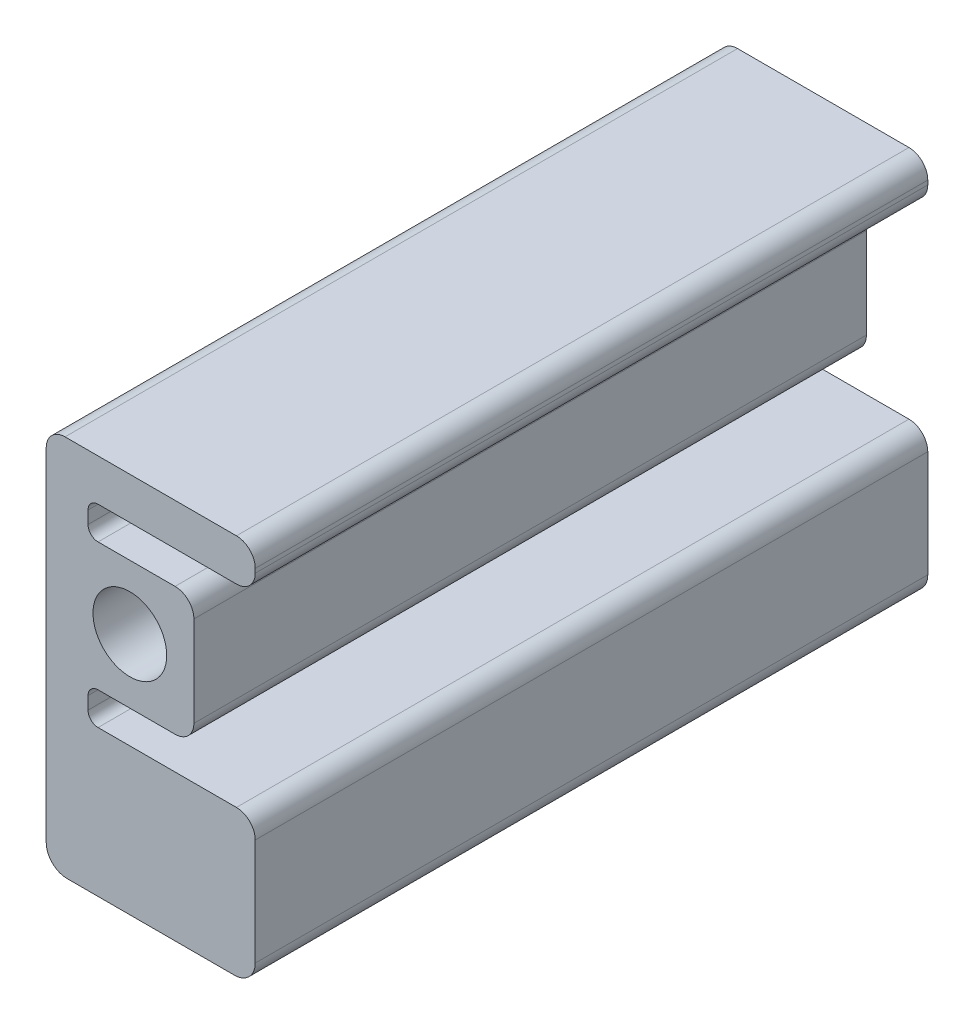
from build123d import *

# Parameters (mm, degrees)
SKETCH1_R           = 11.2
BOSS_EXTRUDE1_DEPTH = 204.313708212


with BuildPart() as part:
    # Sketch1 → Boss-Extrude1 (new body)
    with BuildSketch(Plane.XY):
        with BuildLine():
            Line((-25.4, -67.479999962), (-25.4, 36.365))
            ThreePointArc((-25.4, 36.365), (-23.726115254, 40.406115254), (-19.685, 42.08))
            Line((-19.685, 42.08), (32.385, 42.08))
            ThreePointArc((32.385, 42.08), (36.426115254, 40.406115254), (38.1, 36.365))
            Line((38.1, 36.365), (38.1, 35.095))
            ThreePointArc((38.1, 35.095), (36.426115254, 31.053884746), (32.385, 29.38))
            Line((32.385, 29.38), (-9.652, 29.38))
            ThreePointArc((-9.652, 29.38), (-11.807261469, 28.487261469), (-12.7, 26.332))
            Line((-12.7, 26.332), (-12.7, 22.503))
            ThreePointArc((-12.7, 22.503), (-11.807261469, 20.347738531), (-9.652, 19.455))
            Line((-9.652, 19.455), (0, 19.455))
            Line((0, 19.455), (13.74, 19.455))
            ThreePointArc((13.74, 19.455), (17.781115254, 17.781115254), (19.455, 13.74))
            Line((19.455, 13.74), (19.455, 0))
            Line((19.455, 0), (19.455, -13.74))
            ThreePointArc((19.455, -13.74), (17.781115254, -17.781115254), (13.74, -19.455))
            Line((13.74, -19.455), (0, -19.455))
            Line((0, -19.455), (-9.652, -19.455))
            ThreePointArc((-9.652, -19.455), (-11.807261469, -20.347738531), (-12.7, -22.503))
            Line((-12.7, -22.503), (-12.7, -26.331999962))
            ThreePointArc((-12.7, -26.331999962), (-11.807261469, -28.487261431), (-9.652, -29.379999962))
            Line((-9.652, -29.379999962), (32.385, -29.379999962))
            ThreePointArc((32.385, -29.379999962), (36.426115254, -31.053884708), (38.1, -35.094999962))
            Line((38.1, -35.094999962), (38.1, -67.479999962))
            ThreePointArc((38.1, -67.479999962), (36.240128061, -71.970128023), (31.75, -73.829999962))
            Line((31.75, -73.829999962), (-19.05, -73.829999962))
            ThreePointArc((-19.05, -73.829999962), (-23.540128061, -71.970128023), (-25.4, -67.479999962))
        make_face()
        Circle(SKETCH1_R, mode=Mode.SUBTRACT)
    extrude(amount=BOSS_EXTRUDE1_DEPTH)


solid = part.part
